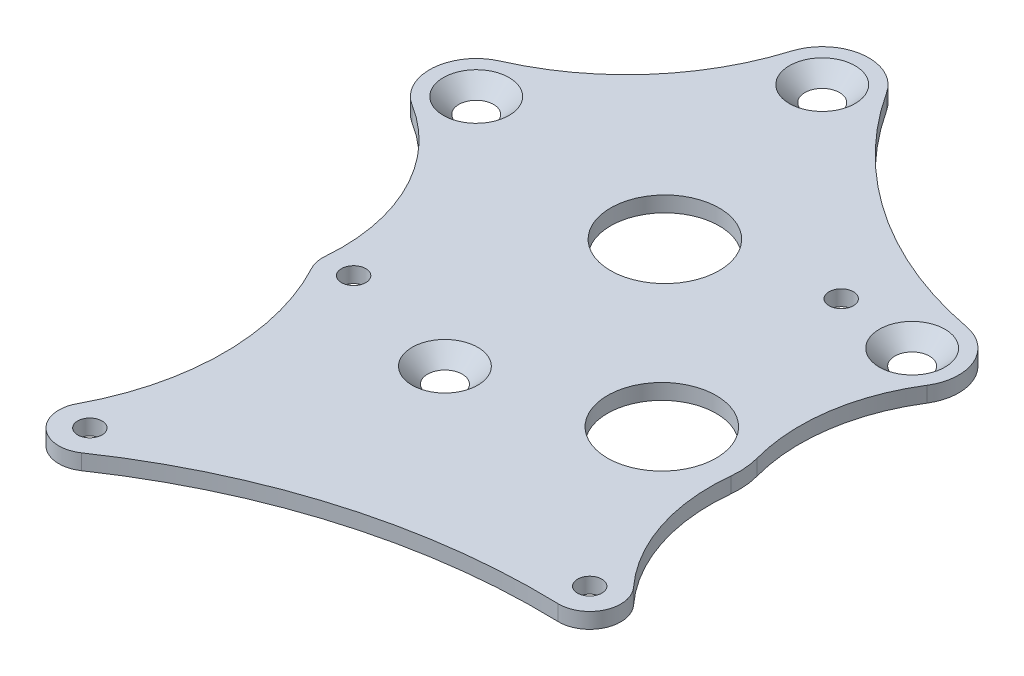
from build123d import *

# Parameters (mm, degrees)
LOWEREDBALLAST_DECK_MOUNT_START       = 6.35
LOWEREDBALLAST_DECK_MOUNT_OUTLINE_R   = 2.5527
LOWEREDBALLAST_DECK_MOUNT_OUTLINE_R_2 = 2.4892
LOWEREDBALLAST_DECK_MOUNT_OUTLINE_R_3 = 8.73125
LOWEREDBALLAST_DECK_MOUNT_DEPTH       = 5.08
BODY_MOVE_COPY2_START                 = 11.43
BODY_MOVE_COPY2_OUTLINE_W             = 5.08
BODY_MOVE_COPY2_OUTLINE_H             = 241.3
BODY_MOVE_COPY2_DEPTH                 = 185.42
BODY_MOVE_COPY2_START_2               = 6.35
BODY_MOVE_COPY2_2_OUTLINE_W           = 5.08
BODY_MOVE_COPY2_2_OUTLINE_H           = 127
BODY_MOVE_COPY2_2_DEPTH               = 5.08
BODY_MOVE_COPY2_3_OUTLINE_R           = 2.5527
BODY_MOVE_COPY2_3_OUTLINE_R_2         = 2.4892
BODY_MOVE_COPY2_3_OUTLINE_R_3         = 8.73125
BODY_MOVE_COPY2_3_DEPTH               = 5.08
SKETCH2_R                             = 2.4892
SKETCH2_R_2                           = 11.1125
BOSS_EXTRUDE2_DEPTH                   = 3.175
BOSS_EXTRUDE3_DEPTH                   = 3.175
CSK_FOR_M6_SFHCS1_AT_2_COUNT          = 2
CSK_FOR_M6_SFHCS1_AT_2_PITCH          = 50.151171472
CSK_FOR_M6_SFHCS1_AT_3_COUNT          = 2
CSK_FOR_M6_SFHCS1_AT_3_PITCH          = 89.2
CSK_FOR_M6_SFHCS1_AT_4_COUNT          = 2
CSK_FOR_M6_SFHCS1_AT_4_PITCH          = 67.750719553


# Read off the part's stored shape, not the designer's step: LoweredBallast_Deck_Mount, Body-Move/Copy2
with BuildPart() as part:
    # LoweredBallast_Deck_Mount outline → LoweredBallast_Deck_Mount (new body)
    with BuildSketch(Plane.YZ.offset(LOWEREDBALLAST_DECK_MOUNT_START)):
        Polygon((6.35, -120.65), (107.712348179, -120.65), (196.85, -56.884227826), (196.85, 56.884227826), (107.712348179, 120.65), (6.35, 120.65), align=None)
        with Locations((15.875, -111.125)):
            Circle(LOWEREDBALLAST_DECK_MOUNT_OUTLINE_R, mode=Mode.SUBTRACT)
        with Locations((49.2125, -13.748153285)):
            Circle(LOWEREDBALLAST_DECK_MOUNT_OUTLINE_R, mode=Mode.SUBTRACT)
        with Locations((61.207670487, -41.07506464)):
            Circle(LOWEREDBALLAST_DECK_MOUNT_OUTLINE_R_2, mode=Mode.SUBTRACT)
        with Locations((96.823134697, -20.21447179)):
            Circle(LOWEREDBALLAST_DECK_MOUNT_OUTLINE_R_3, mode=Mode.SUBTRACT)
        with Locations((104.656174089, -111.125)):
            Circle(LOWEREDBALLAST_DECK_MOUNT_OUTLINE_R, mode=Mode.SUBTRACT)
        with Locations((137.869384338, -15.875)):
            Circle(LOWEREDBALLAST_DECK_MOUNT_OUTLINE_R_2, mode=Mode.SUBTRACT)
        with Locations((187.325, -51.986786112)):
            Circle(LOWEREDBALLAST_DECK_MOUNT_OUTLINE_R, mode=Mode.SUBTRACT)
        with Locations((15.875, 0)):
            Circle(LOWEREDBALLAST_DECK_MOUNT_OUTLINE_R, mode=Mode.SUBTRACT)
        with Locations((49.2125, 13.748153285)):
            Circle(LOWEREDBALLAST_DECK_MOUNT_OUTLINE_R, mode=Mode.SUBTRACT)
        with Locations((38.1, 38.1)):
            Circle(LOWEREDBALLAST_DECK_MOUNT_OUTLINE_R_2, mode=Mode.SUBTRACT)
        with Locations((57.15, 0)):
            Circle(LOWEREDBALLAST_DECK_MOUNT_OUTLINE_R_3, mode=Mode.SUBTRACT)
        with Locations((73.025, 0)):
            Circle(LOWEREDBALLAST_DECK_MOUNT_OUTLINE_R, mode=Mode.SUBTRACT)
        with Locations((92.075, 38.1)):
            Circle(LOWEREDBALLAST_DECK_MOUNT_OUTLINE_R_2, mode=Mode.SUBTRACT)
        with Locations((15.875, 111.125)):
            Circle(LOWEREDBALLAST_DECK_MOUNT_OUTLINE_R, mode=Mode.SUBTRACT)
        with Locations((187.325, 51.986786112)):
            Circle(LOWEREDBALLAST_DECK_MOUNT_OUTLINE_R, mode=Mode.SUBTRACT)
        with Locations((104.656174089, 111.125)):
            Circle(LOWEREDBALLAST_DECK_MOUNT_OUTLINE_R, mode=Mode.SUBTRACT)
    extrude(amount=LOWEREDBALLAST_DECK_MOUNT_DEPTH)

    # Body-Move/Copy2 outline → Body-Move/Copy2 (cut)
    with BuildSketch(Plane(origin=(0, 0, 0), x_dir=(1, 0, 0), z_dir=(0, 1, 0)).offset(BODY_MOVE_COPY2_START)):
        with Locations((8.89, 0)):
            Rectangle(BODY_MOVE_COPY2_OUTLINE_W, BODY_MOVE_COPY2_OUTLINE_H)
    extrude(amount=BODY_MOVE_COPY2_DEPTH, mode=Mode.SUBTRACT)

    # Body-Move_Copy2 2 outline → Body-Move_Copy2 2 (cut)
    with BuildSketch(Plane(origin=(0, 0, 0), x_dir=(1, 0, 0), z_dir=(0, 1, 0)).offset(BODY_MOVE_COPY2_START_2)):
        with Locations((8.89, -57.15)):
            Rectangle(BODY_MOVE_COPY2_2_OUTLINE_W, BODY_MOVE_COPY2_2_OUTLINE_H)
        with BuildLine():
            ThreePointArc((11.43, 50.281351083), (11.195453285, 49.2125), (11.43, 48.143648917))
            Line((11.43, 48.143648917), (11.43, 50.281351083))
        make_face()
        with BuildLine():
            Line((6.35, 63.142681083), (6.35, 51.157318917))
            ThreePointArc((6.35, 51.157318917), (8.73125, 57.15), (6.35, 63.142681083))
        make_face()
    extrude(amount=BODY_MOVE_COPY2_2_DEPTH, mode=Mode.SUBTRACT)

    # Body-Move_Copy2 3 outline → Body-Move_Copy2 3 (add)
    with BuildSketch(Plane(origin=(0, 0, 0), x_dir=(1, 0, 0), z_dir=(0, 1, 0)).offset(BODY_MOVE_COPY2_START_2)):
        with BuildLine():
            Line((120.65, 6.35), (120.65, 107.712348179))
            Line((120.65, 107.712348179), (56.884227826, 196.85))
            Line((56.884227826, 196.85), (-56.884227826, 196.85))
            Line((-56.884227826, 196.85), (-120.65, 107.712348179))
            Line((-120.65, 107.712348179), (-120.65, 6.35))
            Line((-120.65, 6.35), (6.35, 6.35))
            Line((6.35, 6.35), (6.35, 51.157318917))
            ThreePointArc((6.35, 51.157318917), (-8.73125, 57.15), (6.35, 63.142681083))
            Line((6.35, 63.142681083), (6.35, 120.65))
            Line((6.35, 120.65), (11.43, 120.65))
            Line((11.43, 120.65), (11.43, 50.281351083))
            ThreePointArc((11.43, 50.281351083), (16.300853285, 49.2125), (11.43, 48.143648917))
            Line((11.43, 48.143648917), (11.43, 6.35))
            Line((11.43, 6.35), (120.65, 6.35))
        make_face()
        with Locations((-111.125, 15.875)):
            Circle(BODY_MOVE_COPY2_3_OUTLINE_R, mode=Mode.SUBTRACT)
        with Locations((0, 15.875)):
            Circle(BODY_MOVE_COPY2_3_OUTLINE_R, mode=Mode.SUBTRACT)
        with Locations((111.125, 15.875)):
            Circle(BODY_MOVE_COPY2_3_OUTLINE_R, mode=Mode.SUBTRACT)
        with Locations((-111.125, 104.656174089)):
            Circle(BODY_MOVE_COPY2_3_OUTLINE_R, mode=Mode.SUBTRACT)
        with Locations((-38.1, 38.1)):
            Circle(BODY_MOVE_COPY2_3_OUTLINE_R_2, mode=Mode.SUBTRACT)
        with Locations((-13.748153285, 49.2125)):
            Circle(BODY_MOVE_COPY2_3_OUTLINE_R, mode=Mode.SUBTRACT)
        with Locations((-38.1, 92.075)):
            Circle(BODY_MOVE_COPY2_3_OUTLINE_R_2, mode=Mode.SUBTRACT)
        with Locations((-51.986786112, 187.325)):
            Circle(BODY_MOVE_COPY2_3_OUTLINE_R, mode=Mode.SUBTRACT)
        with Locations((0, 73.025)):
            Circle(BODY_MOVE_COPY2_3_OUTLINE_R, mode=Mode.SUBTRACT)
        with Locations((41.07506464, 61.207670487)):
            Circle(BODY_MOVE_COPY2_3_OUTLINE_R_2, mode=Mode.SUBTRACT)
        with Locations((20.21447179, 96.823134697)):
            Circle(BODY_MOVE_COPY2_3_OUTLINE_R_3, mode=Mode.SUBTRACT)
        with Locations((111.125, 104.656174089)):
            Circle(BODY_MOVE_COPY2_3_OUTLINE_R, mode=Mode.SUBTRACT)
        with Locations((15.875, 137.869384338)):
            Circle(BODY_MOVE_COPY2_3_OUTLINE_R_2, mode=Mode.SUBTRACT)
        with Locations((51.986786112, 187.325)):
            Circle(BODY_MOVE_COPY2_3_OUTLINE_R, mode=Mode.SUBTRACT)
    extrude(amount=BODY_MOVE_COPY2_3_DEPTH)


with BuildPart() as body_2:
    # Sketch2 → Boss-Extrude2 (new body)
    with BuildSketch(Plane(origin=(0, 11.43, 0), x_dir=(1, 0, 0), z_dir=(0, 1, 0))):
        with BuildLine():
            ThreePointArc((-43.697395055, 41.098611111), (-42.344618776, 33.377107725), (-34.523029987, 32.853307182))
            ThreePointArc((-34.523029987, 32.853307182), (1.435165075, 49.833263975), (40.88179348, 54.860612408))
            ThreePointArc((40.88179348, 54.860612408), (46.845610099, 58.557518585), (45.763526107, 65.490289905))
            ThreePointArc((45.763526107, 65.490289905), (37.701905828, 79.281344599), (36.002655059, 95.16515579))
            ThreePointArc((36.002655059, 95.16515579), (35.295571353, 101.780559529), (31.939672665, 107.525250816))
            ThreePointArc((31.939672665, 107.525250816), (23.883267234, 121.31935255), (22.19002211, 137.203805076))
            ThreePointArc((22.19002211, 137.203805076), (20.070189732, 142.636236875), (14.412445618, 144.048658946))
            ThreePointArc((14.412445618, 144.048658946), (3.462344959, 143.086426048), (-7.306729609, 145.290429122))
            ThreePointArc((-7.306729609, 145.290429122), (-22.309274144, 142.996002148), (-28.529000968, 129.152023822))
            ThreePointArc((-28.529000968, 129.152023822), (-31.43370737, 111.399097034), (-42.15980047, 96.957675511))
            ThreePointArc((-42.15980047, 96.957675511), (-44.332497578, 93.290925139), (-43.697395055, 89.076388889))
            ThreePointArc((-43.697395055, 89.076388889), (-37.676555497, 65.0875), (-43.697395055, 41.098611111))
        make_face()
        with Locations(Location((-38.1, 92.075, 0), (0, 0, 270))):
            Circle(SKETCH2_R, mode=Mode.SUBTRACT)
        with Locations(Location((15.875, 137.869384338, 0), (0, 0, 270))):
            Circle(SKETCH2_R, mode=Mode.SUBTRACT)
        with Locations(Location((41.07506464, 61.207670487, 0), (0, 0, 270))):
            Circle(SKETCH2_R, mode=Mode.SUBTRACT)
        with Locations(Location((20.21447179, 96.823134697, 0), (0, 0, 270))):
            Circle(SKETCH2_R_2, mode=Mode.SUBTRACT)
        with Locations(Location((-12.7, 130.359646842, 0), (0, 0, 270))):
            Circle(SKETCH2_R_2, mode=Mode.SUBTRACT)
        with Locations(Location((-38.1, 38.1, 0), (0, 0, 270))):
            Circle(SKETCH2_R, mode=Mode.SUBTRACT)
    extrude(amount=BOSS_EXTRUDE2_DEPTH)

    # Sketch5 → Boss-Extrude3 (add)
    with BuildSketch(Plane(origin=(0, 14.605, 0), x_dir=(1, 0, 0), z_dir=(0, 1, 0))):
        with BuildLine():
            ThreePointArc((-61.148803131, 145.072415601), (-66.802064537, 137.020248494), (-62.317406726, 128.263273904))
            ThreePointArc((-62.317406726, 128.263273904), (-48.335449579, 112.968704409), (-44.42671909, 92.618254593))
            ThreePointArc((-44.42671909, 92.618254593), (-43.728284874, 95.015222675), (-42.15980047, 96.957675511))
            ThreePointArc((-42.15980047, 96.957675511), (-31.43370737, 111.399097034), (-28.529000968, 129.152023822))
            ThreePointArc((-28.529000968, 129.152023822), (-22.309274144, 142.996002148), (-7.306729609, 145.290429122))
            ThreePointArc((-7.306729609, 145.290429122), (3.462344959, 143.086426048), (14.412445618, 144.048658946))
            ThreePointArc((14.412445618, 144.048658946), (20.070189732, 142.636236875), (22.19002211, 137.203805076))
            ThreePointArc((22.19002211, 137.203805076), (23.883267234, 121.31935255), (31.939672665, 107.525250816))
            ThreePointArc((31.939672665, 107.525250816), (34.118030208, 104.485163692), (35.524712446, 101.019818631))
            ThreePointArc((35.524712446, 101.019818631), (34.573862159, 116.629433393), (39.973858004, 131.306089488))
            ThreePointArc((39.973858004, 131.306089488), (40.627735004, 140.174390174), (33.674724287, 145.71785066))
            ThreePointArc((33.674724287, 145.71785066), (5.421674261, 157.303422607), (-16.014164602, 179.051183993))
            ThreePointArc((-16.014164602, 179.051183993), (-25.324336968, 183.292130958), (-33.106697868, 176.65136297))
            ThreePointArc((-33.106697868, 176.65136297), (-43.690598599, 157.809698398), (-61.148803131, 145.072415601))
        make_face()
    extrude(amount=-BOSS_EXTRUDE3_DEPTH)

    # Sketch7 → CSK for M6 SFHCS1 (revolve, cut)
    with BuildSketch(Plane(origin=(-57.3, 14.605, -136.359646842), x_dir=(0, 0, 1), z_dir=(1, 0, 0))):
        Polygon((0, 0), (0, 3.175), (3.3, 3.175), (3.3, 3.42), (6.72, 0), align=None)
    csk_for_m6_sfhcs1 = revolve(axis=Axis((-57.3, 20.955, -136.359646842), (0, -1, 0)), mode=Mode.SUBTRACT)

    # CSK for M6 SFHCS1 at 2: CSK for M6 SFHCS1 ×2
    with Locations(*[Vector(0.663992465633312, -2.603373438029753e-15, -0.7477392631005777) * (i * CSK_FOR_M6_SFHCS1_AT_2_PITCH) for i in range(1, CSK_FOR_M6_SFHCS1_AT_2_COUNT)]):
        add(csk_for_m6_sfhcs1, mode=Mode.SUBTRACT)

    # CSK for M6 SFHCS1 at 3: CSK for M6 SFHCS1 ×2
    with Locations(*[(i * CSK_FOR_M6_SFHCS1_AT_3_PITCH, 0, 0) for i in range(1, CSK_FOR_M6_SFHCS1_AT_3_COUNT)]):
        add(csk_for_m6_sfhcs1, mode=Mode.SUBTRACT)

    # CSK for M6 SFHCS1 at 4: CSK for M6 SFHCS1 ×2
    with Locations(*[Vector(0.6582955914566169, 2.6219010677824987e-15, 0.7527595328315564) * (i * CSK_FOR_M6_SFHCS1_AT_4_PITCH) for i in range(1, CSK_FOR_M6_SFHCS1_AT_4_COUNT)]):
        add(csk_for_m6_sfhcs1, mode=Mode.SUBTRACT)


solid = body_2.part
